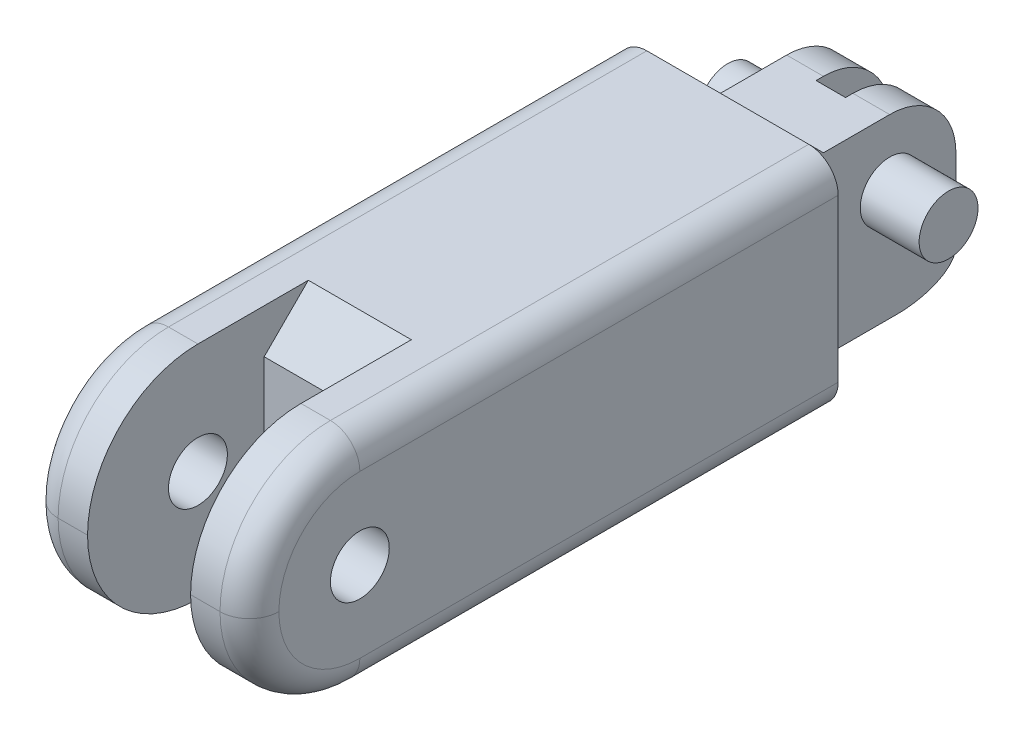
from build123d import *

# Parameters (mm, degrees)
SKETCH1_W                = 15
SKETCH1_H                = 15
BOSS_EXTRUDE1_DEPTH      = 55
SKETCH3_W                = 7
SKETCH3_H                = 15
CUT_EXTRUDE1_DEPTH       = 12
SKETCH4_R                = 2
CUT_EXTRUDE2_DEPTH       = 15
SKETCH5_W                = 4
SKETCH5_H                = 15
CUT_EXTRUDE3_DEPTH       = 15
BOSS_EXTRUDE2_DEPTH      = 7.5
BOSS_EXTRUDE2_DEPTH_BACK = 7.5
SKETCH6_R                = 2
FILLET1_R                = 7.5
CUT_EXTRUDE6_DEPTH       = 3.5
CUT_EXTRUDE6_DEPTH_BACK  = 3.5
FILLET2_R                = 2
CUT_EXTRUDE7_DEPTH       = 7.5
CUT_EXTRUDE7_DEPTH_BACK  = 7.5
FILLET3_SIZE             = 4
FILLET3_SIZE_2           = 2
CUT_EXTRUDE8_DEPTH       = 1
CUT_EXTRUDE8_DEPTH_BACK  = 1


# Some blends are built 0.0001 mm under size
with BuildPart() as part:
    # Sketch1 → Boss-Extrude1 (new body)
    with BuildSketch(Plane.XY):
        Rectangle(SKETCH1_W, SKETCH1_H)
    extrude(amount=BOSS_EXTRUDE1_DEPTH)

    # Sketch3 → Cut-Extrude1 (cut)
    with BuildSketch(Plane.XY.offset(55)):
        Rectangle(SKETCH3_W, SKETCH3_H)
    extrude(amount=-CUT_EXTRUDE1_DEPTH, mode=Mode.SUBTRACT)

    # Sketch4 → Cut-Extrude2 (cut)
    with BuildSketch(Plane(origin=(7.5, 0, 0), x_dir=(0, 0, -1), z_dir=(1, 0, 0))):
        with Locations(Location((-47.5, 0, 0), (0, 0, 90))):
            Circle(SKETCH4_R)
    extrude(amount=-CUT_EXTRUDE2_DEPTH, mode=Mode.SUBTRACT)

    # Sketch5 → Cut-Extrude3 (cut)
    with BuildSketch(Plane(origin=(0, 0, 0), x_dir=(-1, 0, 0), z_dir=(0, 0, -1))):
        with Locations((-5.5, 0)):
            Rectangle(SKETCH5_W, SKETCH5_H)
        with Locations((5.5, 0)):
            Rectangle(SKETCH5_W, SKETCH5_H)
    extrude(amount=-CUT_EXTRUDE3_DEPTH, mode=Mode.SUBTRACT)

    # Sketch6 → Boss-Extrude2 (add, two sides: drawn at the far end of the back side and taken through both)
    with BuildSketch(Plane(origin=(0, 0, 0), x_dir=(0, 0, -1), z_dir=(1, 0, 0)).offset(-BOSS_EXTRUDE2_DEPTH_BACK)):
        with Locations((-7.5, 0)):
            Circle(SKETCH6_R)
    extrude(amount=BOSS_EXTRUDE2_DEPTH + BOSS_EXTRUDE2_DEPTH_BACK)

    # Fillet1
    fillet1_edges = [part.edges().sort_by_distance(p)[0] for p in [
        (5.5, -7.5, 55),
        (-5.5, -7.5, 55),
        (-5.5, 7.5, 55),
        (5.5, 7.5, 55),
    ]]
    fillet(fillet1_edges, radius=FILLET1_R - 0.0001)  # a hair under: the kernel refuses the full size

    # Sketch7 → Cut-Extrude6 (cut, two sides: drawn at the far end of the back side and taken through both)
    with BuildSketch(Plane(origin=(0, 0, 0), x_dir=(0, 0, -1), z_dir=(1, 0, 0)).offset(-CUT_EXTRUDE6_DEPTH_BACK)):
        Polygon((-43, 7.5), (-43, 4.5), (-40, 7.5), align=None)
    extrude(amount=CUT_EXTRUDE6_DEPTH + CUT_EXTRUDE6_DEPTH_BACK, mode=Mode.SUBTRACT)

    # Fillet2
    fillet2_edges = [part.edges().sort_by_distance(p)[0] for p in [
        (7.5, -7.5, 31.25005),
        (7.5, 7.5, 31.25005),
        (7.5, 5.303330148, 52.803330148),
        (7.5, -5.303330148, 52.803330148),
        (-7.5, -7.5, 31.25005),
        (-7.5, 7.5, 31.25005),
        (-7.5, 5.303330148, 52.803330148),
        (-7.5, -5.303330148, 52.803330148),
    ]]
    fillet(fillet2_edges, radius=FILLET2_R)

    # Sketch8 → Cut-Extrude7 (cut, two sides: drawn at the far end of the back side and taken through both)
    with BuildSketch(Plane(origin=(0, 0, 0), x_dir=(0, 0, -1), z_dir=(1, 0, 0)).offset(-CUT_EXTRUDE7_DEPTH_BACK)):
        with BuildLine():
            Line((-15, 7.5), (-12, 4.5))
            Line((-12, 4.5), (-7.5, 4.5))
            ThreePointArc((-7.5, 4.5), (-4.318019485, 3.181980515), (-3, 0))
            Line((-3, 0), (-3, -7.5))
            Line((-3, -7.5), (0, -7.5))
            Line((0, -7.5), (0, 7.5))
            Line((0, 7.5), (-15, 7.5))
        make_face()
    extrude(amount=CUT_EXTRUDE7_DEPTH + CUT_EXTRUDE7_DEPTH_BACK, mode=Mode.SUBTRACT)

    # Fillet3
    # an asymmetric fillet: 4, 2 mm, written as the material it takes off along each edge
    with BuildSketch(Plane(origin=(-13.5, -7.5, 3), x_dir=(0, 0, 1), z_dir=(1, 0, 0))) as fillet3_piece_1:
        with BuildLine():
            Bezier((FILLET3_SIZE, 0), (0, 0), (0, -FILLET3_SIZE_2), weights=[1, 0.707106781, 1])
            Line((0, -FILLET3_SIZE_2), (0, 0))
            Line((0, 0), (FILLET3_SIZE, 0))
        make_face()
    extrude(amount=27, mode=Mode.SUBTRACT)

    # Sketch9 → Cut-Extrude8 (cut, two sides: drawn at the far end of the back side and taken through both)
    with BuildSketch(Plane(origin=(0, 0, 0), x_dir=(0, 0, -1), z_dir=(1, 0, 0)).offset(-CUT_EXTRUDE8_DEPTH_BACK)):
        with BuildLine():
            Line((-8, -0.5), (-8, 9.147620524))
            ThreePointArc((-8, 9.147620524), (-1.178102105, 6.321897895), (1.647620524, -0.5))
            Line((1.647620524, -0.5), (-8, -0.5))
        make_face()
    extrude(amount=CUT_EXTRUDE8_DEPTH + CUT_EXTRUDE8_DEPTH_BACK, mode=Mode.SUBTRACT)


solid = part.part
